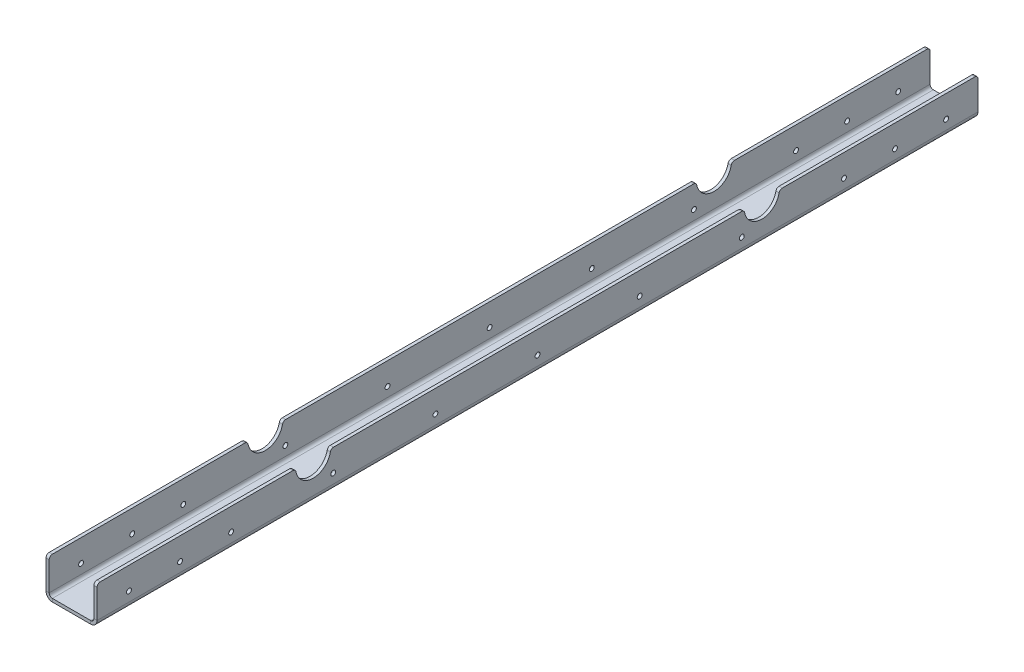
from build123d import *

# Parameters (mm, degrees)
BASE_FLANGE1_DEPTH = 876.3
SKETCH6_R          = 2.4257
SKETCH6_R_2        = 17.4625
CUT_EXTRUDE1_DEPTH = 879.597712267
FILLET1_R          = 3.175
SKETCH8_R          = 3.3782
SKETCH8_R_2        = 4.3688
CUT_EXTRUDE2_DEPTH = 879.597712267


# Sheet-metal steps are written as plain solids
with BuildPart() as part:
    # Sketch1 → Base-Flange1 (new body)
    with BuildSketch(Plane.XY):
        with BuildLine():
            Line((50.8, 38.1), (50.8, 6.35))
            ThreePointArc((50.8, 6.35), (48.940128061, 1.859871939), (44.45, 0))
            Line((44.45, 0), (6.35, 0))
            ThreePointArc((6.35, 0), (1.859871939, 1.859871939), (0, 6.35))
            Line((0, 6.35), (0, 38.1))
            Line((0, 38.1), (3.175, 38.1))
            Line((3.175, 38.1), (3.175, 6.35))
            ThreePointArc((3.175, 6.35), (4.10493597, 4.10493597), (6.35, 3.175))
            Line((6.35, 3.175), (44.45, 3.175))
            ThreePointArc((44.45, 3.175), (46.69506403, 4.10493597), (47.625, 6.35))
            Line((47.625, 6.35), (47.625, 38.1))
            Line((47.625, 38.1), (50.8, 38.1))
        make_face()
    extrude(amount=BASE_FLANGE1_DEPTH)

    # Sketch6 → Cut-Extrude1 (cut, through all)
    with BuildSketch(Plane(origin=(50.8, 0, 0), x_dir=(0, 0, -1), z_dir=(1, 0, 0))):
        with Locations((-438.15, 15.875)):
            Circle(SKETCH6_R)
        with Locations((-336.55, 15.875)):
            Circle(SKETCH6_R)
        with Locations((-234.95, 15.875)):
            Circle(SKETCH6_R)
        with Locations((-133.35, 15.875)):
            Circle(SKETCH6_R)
        with Locations((-31.75, 15.875)):
            Circle(SKETCH6_R)
        with Locations((-844.55, 15.875)):
            Circle(SKETCH6_R)
        with Locations((-742.95, 15.875)):
            Circle(SKETCH6_R)
        with Locations((-641.35, 15.875)):
            Circle(SKETCH6_R)
        with Locations((-539.75, 15.875)):
            Circle(SKETCH6_R)
        with Locations((-661.3398, 38.9255)):
            Circle(SKETCH6_R_2)
        with Locations((-214.9602, 38.9255)):
            Circle(SKETCH6_R_2)
        with Locations((-793.75, 15.875)):
            Circle(SKETCH6_R)
        with Locations((-82.55, 15.875)):
            Circle(SKETCH6_R)
    extrude(amount=-CUT_EXTRUDE1_DEPTH, mode=Mode.SUBTRACT)

    # Fillet1
    fillet1_edges = [part.edges().sort_by_distance(p)[0] for p in [
        (1.5875, 38.1, 0),
        (1.5875, 38.1, 678.782777269),
        (1.5875, 38.1, 643.896822731),
        (49.2125, 38.1, 678.782777269),
        (49.2125, 38.1, 643.896822731),
        (1.5875, 38.1, 232.403177269),
        (1.5875, 38.1, 197.517222731),
        (49.2125, 38.1, 232.403177269),
        (49.2125, 38.1, 197.517222731),
        (49.2125, 38.1, 0),
        (1.5875, 38.1, 876.3),
        (49.2125, 38.1, 876.3),
    ]]
    fillet(fillet1_edges, radius=FILLET1_R)

    # Sketch8 → Cut-Extrude2 (cut, through all)
    with BuildSketch(Plane.XZ):
        with Locations(Location((25.4, 800.1, 0), (0, 0, 270))):
            Circle(SKETCH8_R)
        with Locations(Location((25.4, 774.7, 0), (0, 0, 270))):
            Circle(SKETCH8_R_2)
        with Locations(Location((25.4, 657.225, 0), (0, 0, 270))):
            Circle(SKETCH8_R)
        with Locations(Location((25.4, 514.35, 0), (0, 0, 270))):
            Circle(SKETCH8_R)
        with Locations(Location((25.4, 539.75, 0), (0, 0, 270))):
            Circle(SKETCH8_R_2)
        with Locations(Location((25.4, 336.55, 0), (0, 0, 270))):
            Circle(SKETCH8_R_2)
        with Locations(Location((25.4, 361.95, 0), (0, 0, 270))):
            Circle(SKETCH8_R)
        with Locations(Location((25.4, 219.075, 0), (0, 0, 270))):
            Circle(SKETCH8_R)
        with Locations(Location((25.4, 101.6, 0), (0, 0, 270))):
            Circle(SKETCH8_R_2)
        with Locations(Location((25.4, 76.2, 0), (0, 0, 270))):
            Circle(SKETCH8_R)
    extrude(amount=-CUT_EXTRUDE2_DEPTH, mode=Mode.SUBTRACT)


solid = part.part
